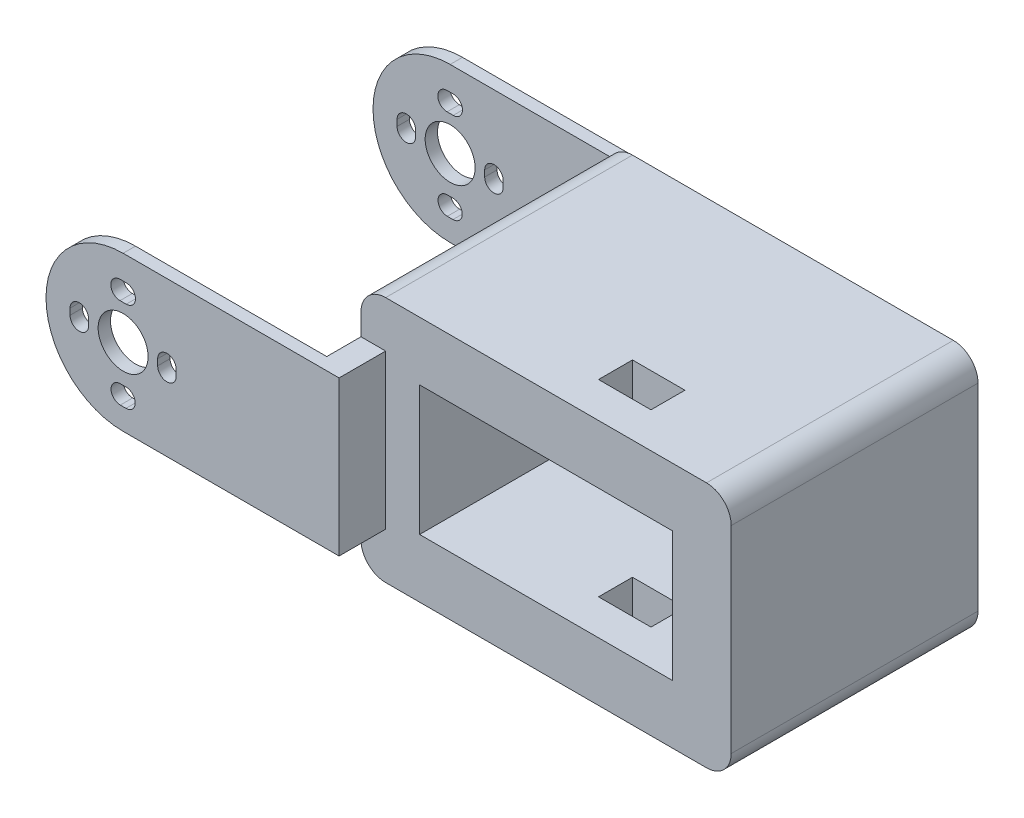
from build123d import *

# Parameters (mm, degrees)
SKETCH1_W           = 60
SKETCH1_H           = 40
SKETCH1_W_2         = 41
SKETCH1_H_2         = 21
BOSS_EXTRUDE1_DEPTH = 40
SKETCH2_W           = 4
SKETCH2_H           = 25
BOSS_EXTRUDE2_DEPTH = 5.55
SKETCH2_2_W         = 4
SKETCH2_2_H         = 25
BOSS_EXTRUDE3_DEPTH = 45.55
SKETCH3_R           = 4.05
BOSS_EXTRUDE6_DEPTH = 2
BOSS_EXTRUDE7_START = -53
SKETCH3_8_R         = 4.05
BOSS_EXTRUDE7_DEPTH = 53
CUT_EXTRUDE1_START  = -51
SKETCH3_11_R        = 4.05
CUT_EXTRUDE1_DEPTH  = 51
SKETCH_1_W          = 8.5
SKETCH_1_H          = 5.5
CUT_EXTRUDE_1_DEPTH = 40
FILLET_2_R          = 4
FILLET_3_R          = 4
FILLET_4_R          = 4
FILLET_5_R          = 4


with BuildPart() as part:
    # Sketch1 → Boss-Extrude1 (new body)
    with BuildSketch(Plane.XY):
        with Locations((0.904162196, -5.136072895)):
            Rectangle(SKETCH1_W, SKETCH1_H)
        with Locations((0.904162196, -5.136072895)):
            Rectangle(SKETCH1_W_2, SKETCH1_H_2, mode=Mode.SUBTRACT)
    extrude(amount=BOSS_EXTRUDE1_DEPTH)

    # Sketch2 → Boss-Extrude2 (add)
    with BuildSketch(Plane.XY.offset(40)):
        with Locations((-27.095837804, -5.136072895)):
            Rectangle(SKETCH2_W, SKETCH2_H)
    extrude(amount=BOSS_EXTRUDE2_DEPTH)

    # Sketch2<2> → Boss-Extrude3 (add)
    with BuildSketch(Plane.XY.offset(40)):
        with Locations((-27.095837804, -5.136072895)):
            Rectangle(SKETCH2_2_W, SKETCH2_2_H)
    extrude(amount=-BOSS_EXTRUDE3_DEPTH)

    # Sketch3 → Boss-Extrude6 (add)
    with BuildSketch(Plane.XY.offset(45.55)):
        with BuildLine():
            Line((-25.095837804, -17.636072895), (-25.095837804, 7.363927105))
            Line((-25.095837804, 7.363927105), (-60.095837804, 7.363927105))
            ThreePointArc((-60.095837804, 7.363927105), (-72.595837804, -5.136072895), (-60.095837804, -17.636072895))
            Line((-60.095837804, -17.636072895), (-25.095837804, -17.636072895))
        make_face()
        with BuildLine():
            Line((-51.495837804, -4.636072895), (-51.495837804, -5.636072895))
            ThreePointArc((-51.495837804, -5.636072895), (-52.995837804, -7.136072895), (-54.495837804, -5.636072895))
            Line((-54.495837804, -5.636072895), (-54.495837804, -4.636072895))
            ThreePointArc((-54.495837804, -4.636072895), (-52.995837804, -3.136072895), (-51.495837804, -4.636072895))
        make_face(mode=Mode.SUBTRACT)
        with BuildLine():
            Line((-59.635749439, -14.176248856), (-60.555926168, -14.176248856))
            ThreePointArc((-60.555926168, -14.176248856), (-62.055926168, -12.676248856), (-60.555926168, -11.176248856))
            Line((-60.555926168, -11.176248856), (-59.635749439, -11.176248856))
            ThreePointArc((-59.635749439, -11.176248856), (-58.135749439, -12.676248856), (-59.635749439, -14.176248856))
        make_face(mode=Mode.SUBTRACT)
        with Locations((-60.095837804, -5.136072895)):
            Circle(SKETCH3_R, mode=Mode.SUBTRACT)
        with BuildLine():
            Line((-59.595837804, 0.463927105), (-60.595837804, 0.463927105))
            ThreePointArc((-60.595837804, 0.463927105), (-62.095837804, 1.963927105), (-60.595837804, 3.463927105))
            Line((-60.595837804, 3.463927105), (-59.595837804, 3.463927105))
            ThreePointArc((-59.595837804, 3.463927105), (-58.095837804, 1.963927105), (-59.595837804, 0.463927105))
        make_face(mode=Mode.SUBTRACT)
        with BuildLine():
            ThreePointArc((-68.695837804, -4.636072895), (-67.195837804, -3.136072895), (-65.695837804, -4.636072895))
            Line((-65.695837804, -4.636072895), (-65.695837804, -5.636072895))
            ThreePointArc((-65.695837804, -5.636072895), (-67.195837804, -7.136072895), (-68.695837804, -5.636072895))
            Line((-68.695837804, -5.636072895), (-68.695837804, -4.636072895))
        make_face(mode=Mode.SUBTRACT)
    extrude(amount=BOSS_EXTRUDE6_DEPTH)

    # Sketch3<8> → Boss-Extrude7 (add)
    with BuildSketch(Plane.XY.offset(45.55).offset(BOSS_EXTRUDE7_START)):
        with BuildLine():
            Line((-25.095837804, -17.636072895), (-25.095837804, 7.363927105))
            Line((-25.095837804, 7.363927105), (-60.095837804, 7.363927105))
            ThreePointArc((-60.095837804, 7.363927105), (-72.595837804, -5.136072895), (-60.095837804, -17.636072895))
            Line((-60.095837804, -17.636072895), (-25.095837804, -17.636072895))
        make_face()
        with BuildLine():
            Line((-51.495837804, -4.636072895), (-51.495837804, -5.636072895))
            ThreePointArc((-51.495837804, -5.636072895), (-52.995837804, -7.136072895), (-54.495837804, -5.636072895))
            Line((-54.495837804, -5.636072895), (-54.495837804, -4.636072895))
            ThreePointArc((-54.495837804, -4.636072895), (-52.995837804, -3.136072895), (-51.495837804, -4.636072895))
        make_face(mode=Mode.SUBTRACT)
        with BuildLine():
            Line((-59.635749439, -14.176248856), (-60.555926168, -14.176248856))
            ThreePointArc((-60.555926168, -14.176248856), (-62.055926168, -12.676248856), (-60.555926168, -11.176248856))
            Line((-60.555926168, -11.176248856), (-59.635749439, -11.176248856))
            ThreePointArc((-59.635749439, -11.176248856), (-58.135749439, -12.676248856), (-59.635749439, -14.176248856))
        make_face(mode=Mode.SUBTRACT)
        with Locations((-60.095837804, -5.136072895)):
            Circle(SKETCH3_8_R, mode=Mode.SUBTRACT)
        with BuildLine():
            Line((-59.595837804, 0.463927105), (-60.595837804, 0.463927105))
            ThreePointArc((-60.595837804, 0.463927105), (-62.095837804, 1.963927105), (-60.595837804, 3.463927105))
            Line((-60.595837804, 3.463927105), (-59.595837804, 3.463927105))
            ThreePointArc((-59.595837804, 3.463927105), (-58.095837804, 1.963927105), (-59.595837804, 0.463927105))
        make_face(mode=Mode.SUBTRACT)
        with BuildLine():
            ThreePointArc((-68.695837804, -4.636072895), (-67.195837804, -3.136072895), (-65.695837804, -4.636072895))
            Line((-65.695837804, -4.636072895), (-65.695837804, -5.636072895))
            ThreePointArc((-65.695837804, -5.636072895), (-67.195837804, -7.136072895), (-68.695837804, -5.636072895))
            Line((-68.695837804, -5.636072895), (-68.695837804, -4.636072895))
        make_face(mode=Mode.SUBTRACT)
    extrude(amount=BOSS_EXTRUDE7_DEPTH)

    # Sketch3<11> → Cut-Extrude1 (cut)
    with BuildSketch(Plane.XY.offset(45.55).offset(CUT_EXTRUDE1_START)):
        with BuildLine():
            Line((-29.095837804, -17.636072895), (-29.095837804, 7.363927105))
            Line((-29.095837804, 7.363927105), (-60.095837804, 7.363927105))
            ThreePointArc((-60.095837804, 7.363927105), (-72.595837804, -5.136072895), (-60.095837804, -17.636072895))
            Line((-60.095837804, -17.636072895), (-29.095837804, -17.636072895))
        make_face()
        with BuildLine():
            Line((-59.635749439, -14.176248856), (-60.555926168, -14.176248856))
            ThreePointArc((-60.555926168, -14.176248856), (-62.055926168, -12.676248856), (-60.555926168, -11.176248856))
            Line((-60.555926168, -11.176248856), (-59.635749439, -11.176248856))
            ThreePointArc((-59.635749439, -11.176248856), (-58.135749439, -12.676248856), (-59.635749439, -14.176248856))
        make_face(mode=Mode.SUBTRACT)
        with Locations((-60.095837804, -5.136072895)):
            Circle(SKETCH3_11_R, mode=Mode.SUBTRACT)
        with BuildLine():
            Line((-59.595837804, 0.463927105), (-60.595837804, 0.463927105))
            ThreePointArc((-60.595837804, 0.463927105), (-62.095837804, 1.963927105), (-60.595837804, 3.463927105))
            Line((-60.595837804, 3.463927105), (-59.595837804, 3.463927105))
            ThreePointArc((-59.595837804, 3.463927105), (-58.095837804, 1.963927105), (-59.595837804, 0.463927105))
        make_face(mode=Mode.SUBTRACT)
        with BuildLine():
            ThreePointArc((-54.495837804, -4.636072895), (-52.995837804, -3.136072895), (-51.495837804, -4.636072895))
            Line((-51.495837804, -4.636072895), (-51.495837804, -5.636072895))
            ThreePointArc((-51.495837804, -5.636072895), (-52.995837804, -7.136072895), (-54.495837804, -5.636072895))
            Line((-54.495837804, -5.636072895), (-54.495837804, -4.636072895))
        make_face(mode=Mode.SUBTRACT)
        with BuildLine():
            ThreePointArc((-68.695837804, -4.636072895), (-67.195837804, -3.136072895), (-65.695837804, -4.636072895))
            Line((-65.695837804, -4.636072895), (-65.695837804, -5.636072895))
            ThreePointArc((-65.695837804, -5.636072895), (-67.195837804, -7.136072895), (-68.695837804, -5.636072895))
            Line((-68.695837804, -5.636072895), (-68.695837804, -4.636072895))
        make_face(mode=Mode.SUBTRACT)
    extrude(amount=CUT_EXTRUDE1_DEPTH, mode=Mode.SUBTRACT)

    # 草圖1 → 除料-伸長1 (cut)
    with BuildSketch(Plane(origin=(0, 14.863927105, 0), x_dir=(1, 0, 0), z_dir=(0, 1, 0))):
        with Locations((7.904162196, -31.5)):
            Rectangle(SKETCH_1_W, SKETCH_1_H)
    extrude(amount=-CUT_EXTRUDE_1_DEPTH, mode=Mode.SUBTRACT)

    # 圓角2
    fillet_2_edges = [part.edges().sort_by_distance(p)[0] for p in [
        (-29.095837804, -25.136072895, 20),
    ]]
    fillet(fillet_2_edges, radius=FILLET_2_R)

    # 圓角3
    fillet_3_edges = [part.edges().sort_by_distance(p)[0] for p in [
        (30.904162196, -25.136072895, 20),
    ]]
    fillet(fillet_3_edges, radius=FILLET_3_R)

    # 圓角4
    fillet_4_edges = [part.edges().sort_by_distance(p)[0] for p in [
        (30.904162196, 14.863927105, 20),
    ]]
    fillet(fillet_4_edges, radius=FILLET_4_R)

    # 圓角5
    fillet_5_edges = [part.edges().sort_by_distance(p)[0] for p in [
        (-29.095837804, 14.863927105, 20),
    ]]
    fillet(fillet_5_edges, radius=FILLET_5_R)


solid = part.part
